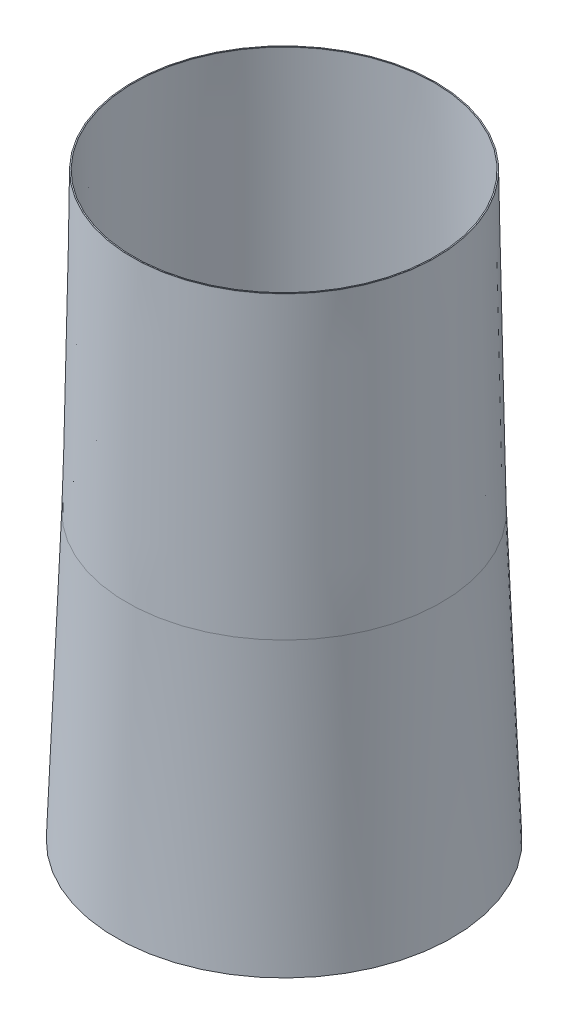
from build123d import *


with BuildPart() as part:
    # Skica1 → Rotovat1 (revolve)
    with BuildSketch(Plane.XY):
        with BuildLine():
            Line((-14.349982858, 244.001851534), (-13.849982858, 271.001851534))
            ThreePointArc((-13.849982858, 271.001851534), (-13.849828576, 271.018515344), (-13.849982858, 271.035179154))
            Line((-13.849982858, 271.035179154), (-13.75, 271.037030688))
            ThreePointArc((-13.75, 271.037030688), (-13.749828576, 271.018515344), (-13.75, 271))
            Line((-13.75, 271), (-14.25, 244))
            ThreePointArc((-14.25, 244), (-14.620475493, 230.995018288), (-15.25, 218))
            Line((-15.25, 218), (-15.349829703, 218.005833564))
            ThreePointArc((-15.349829703, 218.005833564), (-14.72040161, 230.9988616), (-14.349982858, 244.001851534))
        make_face()
    revolve(axis=Axis((0, 0, 0), (0, 1, 0)))


solid = part.part
